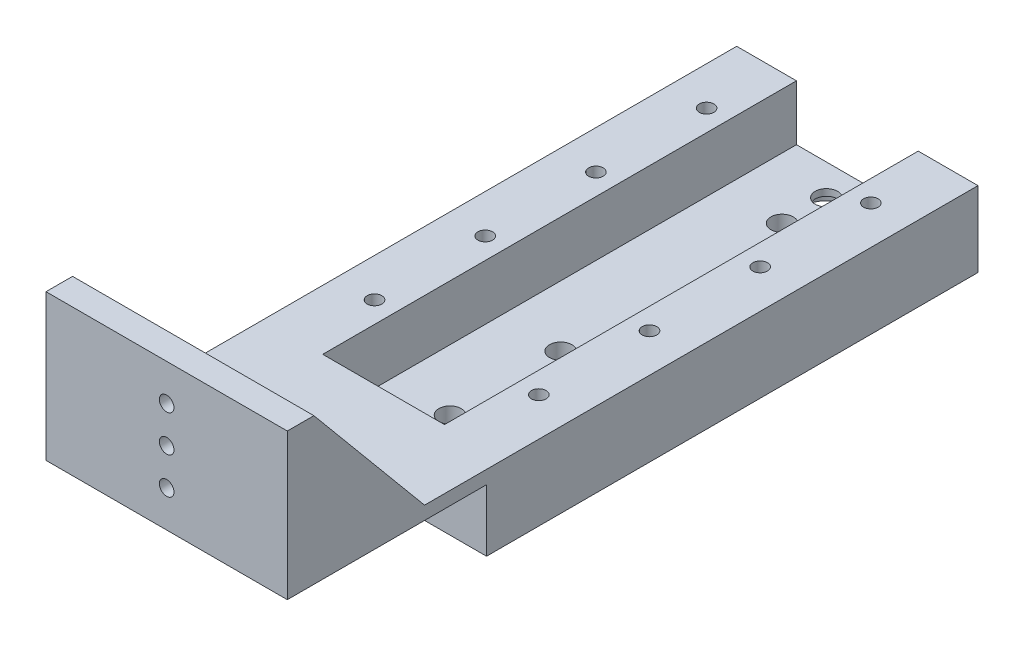
from build123d import *

# Parameters (mm, degrees)
SKETCH1_W                           = 54.5
SKETCH1_H                           = 111
BOSS_EXTRUDE1_DEPTH                 = 4.5
SKETCH2_W                           = 13.5
SKETCH2_H                           = 111
BOSS_EXTRUDE2_DEPTH                 = 12.5
M4X0_7_TAPPED_HOLE1_D               = 3.3
SKETCH6_W                           = 4
SKETCH6_H                           = 12.5
BOSS_EXTRUDE3_DEPTH                 = 37
SKETCH7_W                           = 54.5
SKETCH7_H                           = 3
BOSS_EXTRUDE5_DEPTH                 = 45
SKETCH8_R                           = 7
CUT_EXTRUDE1_DEPTH                  = 3
M2_CLEARANCE_HOLE1_D                = 2.4
F_8_0_199_DIAMETER_HOLE1_D          = 5.0546
SKETCH12_R                          = 5.5
CUT_EXTRUDE3_DEPTH                  = 3
SKETCH13_W                          = 27.5
SKETCH13_H                          = 9.513667368
CUT_EXTRUDE4_DEPTH                  = 5
SKETCH14_W                          = 54.5
SKETCH14_H                          = 6
BOSS_EXTRUDE6_DEPTH                 = 30
RIB6_REACH                          = 124.903
SKETCH20_WALL_W                     = 286.858082508
SKETCH20_WALL_H                     = 10
TAP_START                           = 50.370687416
TAP_DRILL_FOR_M4X0_7_TAP1_OUTLINE_R = 1.65
TAP_DRILL_FOR_M4X0_7_TAP1_DEPTH     = 6
TAP_START_2                         = -40.649543841
TAP_DRILL_FOR_M4X0_7_TAP1_2_DEPTH   = 10


with BuildPart() as part:
    # Sketch1 → Boss-Extrude1 (new body)
    with BuildSketch(Plane(origin=(0, 0, 0), x_dir=(1, 0, 0), z_dir=(0, 1, 0))):
        with Locations((-13.399543841, 44.129312584)):
            Rectangle(SKETCH1_W, SKETCH1_H)
    extrude(amount=BOSS_EXTRUDE1_DEPTH)

    # Sketch2 → Boss-Extrude2 (add)
    with BuildSketch(Plane(origin=(0, 4.5, 0), x_dir=(1, 0, 0), z_dir=(0, 1, 0))):
        with Locations((7.100456159, 44.129312584)):
            Rectangle(SKETCH2_W, SKETCH2_H)
        with Locations((-33.899543841, 44.129312584)):
            Rectangle(SKETCH2_W, SKETCH2_H)
    extrude(amount=BOSS_EXTRUDE2_DEPTH)

    # M4x0.7 Tapped Hole1 (through all)
    with Locations(Plane(origin=(-31.949543841, 17, -9.129312584), x_dir=(0, 0, 1), z_dir=(0, 1, 0))):
        with Locations((0, 0), (-25, 0), (-50, 0), (-75, 0), (0, 37.1), (-25, 37.1), (-50, 37.1), (-75, 37.1)):
            Hole(M4X0_7_TAPPED_HOLE1_D / 2)

    # Sketch6 → Boss-Extrude3 (add)
    with BuildSketch(Plane(origin=(-27.149543841, 0, 0), x_dir=(0, 0, -1), z_dir=(1, 0, 0))):
        with Locations((-9.370687416, 10.75)):
            Rectangle(SKETCH6_W, SKETCH6_H)
    extrude(amount=BOSS_EXTRUDE3_DEPTH)

    # Sketch7 → Boss-Extrude5 (add)
    with BuildSketch(Plane.XY.offset(11.370687416)):
        with Locations((-13.399543841, 15.5)):
            Rectangle(SKETCH7_W, SKETCH7_H)
    extrude(amount=BOSS_EXTRUDE5_DEPTH)

    # Sketch8 → Cut-Extrude1 (cut)
    with BuildSketch(Plane(origin=(0, 17, 0), x_dir=(1, 0, 0), z_dir=(0, 1, 0))):
        with Locations(Location((-13.399543841, -30.870687416, 0), (0, 0, 270))):
            Circle(SKETCH8_R)
    extrude(amount=-CUT_EXTRUDE1_DEPTH, mode=Mode.SUBTRACT)

    # M2 Clearance Hole1 (through all)
    with Locations(Plane(origin=(-20.200285158, 17, 29.83376219), x_dir=(0, 0, 1), z_dir=(0, 1, 0))):
        with Locations((0, 0), (-6.963074774, 6.800741317), (9.036925226, 6.800741317), (-0.001679632, 13.599250141)):
            Hole(M2_CLEARANCE_HOLE1_D / 2)

    # #8 (0.199) Diameter Hole1 (through all)
    with Locations(Plane(origin=(-13.399543841, 4.5, 2.370687416), x_dir=(0, 0, 1), z_dir=(0, 1, 0))):
        with Locations((0, 0), (-10, 0), (-35, 0), (-85, 0), (-95, 0)):
            Hole(F_8_0_199_DIAMETER_HOLE1_D / 2)

    # Sketch12 → Cut-Extrude3 (cut)
    with BuildSketch(Plane(origin=(0, 0, 0), x_dir=(-1, 0, 0), z_dir=(0, -1, 0))):
        with Locations(Location((13.399543841, 92.629312584, 0), (0, 0, 90))):
            Circle(SKETCH12_R)
    extrude(amount=-CUT_EXTRUDE3_DEPTH, mode=Mode.SUBTRACT)

    # Sketch13 → Cut-Extrude4 (cut)
    with BuildSketch(Plane.XY.offset(11.370687416)):
        with Locations((-13.399543841, 9.243166316)):
            Rectangle(SKETCH13_W, SKETCH13_H)
    extrude(amount=-CUT_EXTRUDE4_DEPTH, mode=Mode.SUBTRACT)

    # Sketch14 → Boss-Extrude6 (add)
    with BuildSketch(Plane(origin=(0, 17, 0), x_dir=(1, 0, 0), z_dir=(0, 1, 0))):
        with Locations((-13.399543841, -53.370687416)):
            Rectangle(SKETCH14_W, SKETCH14_H)
    extrude(amount=BOSS_EXTRUDE6_DEPTH)

    # Sketch20 wall → Rib6 (add, up to next)
    with BuildSketch(Plane(origin=(13.850456159, 32, 37.870687416), x_dir=(0, -0.768221279597, -0.640184399664), z_dir=(0, 0.640184399664, -0.768221279597)), mode=Mode.PRIVATE) as rib6_sk1:
        with Locations((0, 5)):
            Rectangle(SKETCH20_WALL_W, SKETCH20_WALL_H)
    rib6_tool1 = extrude(rib6_sk1.sketch, amount=-RIB6_REACH, mode=Mode.PRIVATE) - part.part
    add(rib6_tool1.solids().sort_by_distance((13.850456159, 32, 37.870687416))[0])

    # Tap Drill for M4x0.7 Tap1: read off the stored shape, not the designer's step
    # Tap Drill for M4x0.7 Tap1 outline → Tap Drill for M4x0.7 Tap1 (cut)
    with BuildSketch(Plane.XY.offset(TAP_START)):
        with Locations((-13.399543841, 30.5)):
            Circle(TAP_DRILL_FOR_M4X0_7_TAP1_OUTLINE_R)
        with Locations((-13.399543841, 38.75)):
            Circle(TAP_DRILL_FOR_M4X0_7_TAP1_OUTLINE_R)
        with Locations((-13.399543841, 22.25)):
            Circle(TAP_DRILL_FOR_M4X0_7_TAP1_OUTLINE_R)
    extrude(amount=TAP_DRILL_FOR_M4X0_7_TAP1_DEPTH, mode=Mode.SUBTRACT)

    # Tap Drill for M4x0.7 Tap1 2 outline → Tap Drill for M4x0.7 Tap1 2 (add)
    with BuildSketch(Plane.YZ.offset(TAP_START_2)):
        Polygon((17, 50.370687416), (17, 25.370687416), (47, 50.370687416), align=None)
    extrude(amount=TAP_DRILL_FOR_M4X0_7_TAP1_2_DEPTH)


solid = part.part
